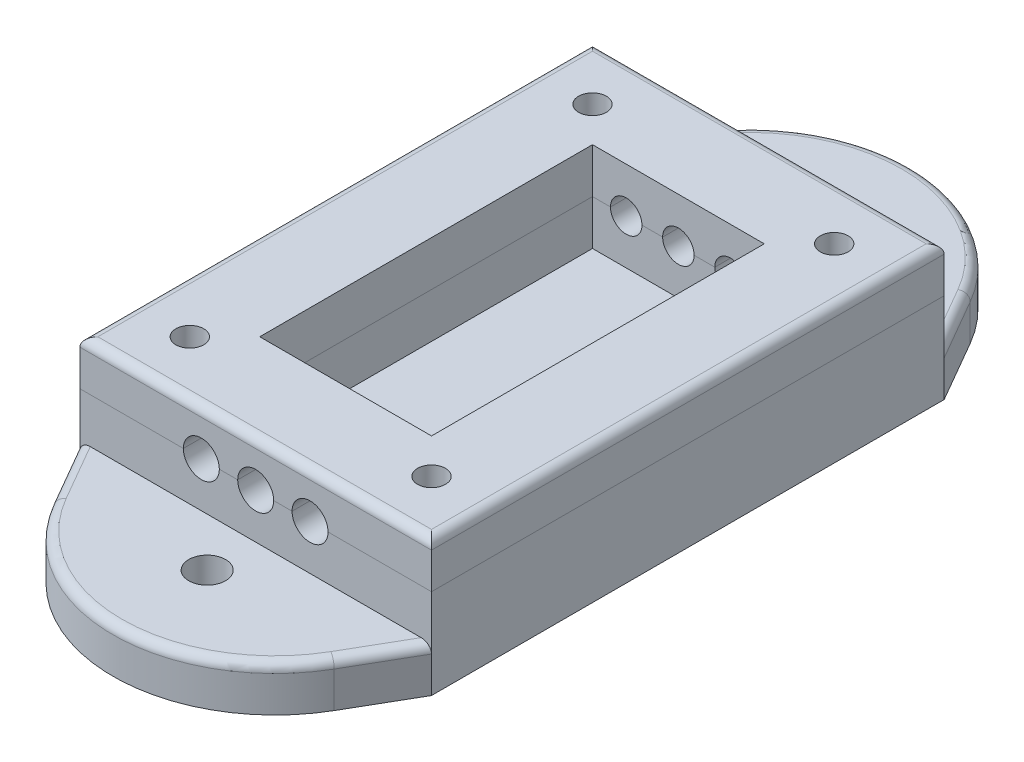
from build123d import *

# Parameters (mm, degrees)
BOSS_EXTRU_1_DEPTH           = 20
CONG_1_R                     = 0.5
CONG_2_R                     = 1
ESQUISSE3_W                  = 39.099999999999994
ESQUISSE3_H                  = 57
ESQUISSE3_R                  = 1.5499999999999992
ESQUISSE3_R_2                = 1.5499999999999883
ESQUISSE3_W_2                = 19.1
ESQUISSE3_H_2                = 37
BOSS_EXTRU_2_DEPTH           = 5
ESQUISSE3_3_W                = 39.099999999999994
ESQUISSE3_3_H                = 57
ESQUISSE3_3_R                = 1.5499999999999992
ESQUISSE3_3_R_2              = 1.5499999999999883
ESQUISSE3_3_W_2              = 19.1
ESQUISSE3_3_H_2              = 37
BOSS_EXTRU_4_DEPTH           = 15
TROUS_MOTEUR_REACH           = 58.757
ESQUISSE8_R                  = 1.7500000000000038
ESQUISSE8_R_2                = 1.750000000000003
ENL_V_MAT_EXTRU_1_DEPTH      = 50.94617008369277
TROUS_CABLES_PUISSANCE_REACH = 58.757
ESQUISSE9_R                  = 2
ESQUISSE9_R_2                = 2.000000000000005
ESQUISSE9_R_3                = 2.0000000000000053
ENL_V_MAT_EXTRU_5_REACH      = 51.946
ESQUISSE12_W                 = 5.9
ESQUISSE12_H                 = 1.620000000000001
ESQUISSE13_R                 = 2.05
BOSS_EXTRU_5_DEPTH           = 5
CONG_3_R                     = 1
FRACTIONNER1_SURFACE_1_BACK  = 99.11
FRACTIONNER1_SURFACE_1_DEPTH = 198.22
FRACTIONNER1_SURFACE_2_BACK  = 99.11
FRACTIONNER1_SURFACE_2_DEPTH = 198.22


with BuildPart() as part:
    # Esquisse1 → Boss.-Extru.1 (new body)
    with BuildSketch(Plane.XY):
        Polygon((-1.176e-14, 10.103135382441117), (-2.578e-14, 4.840000000000001), (3.5, 4.840000000000001), (5.71, 6.983135382441116), (5.71, 8.483135382441116), (2.95, 8.483135382441116), (2.95, 10.103135382441117), align=None)
        Polygon((-3.5, 4.840000000000001), (-2.576e-14, 4.840000000000001), (-1.176e-14, 10.103135382441117), (-2.95, 10.103135382441117), (-2.95, 8.483135382441116), (-5.71, 8.483135382441116), (-5.71, 6.983135382441116), align=None)
    extrude(amount=-BOSS_EXTRU_1_DEPTH)

    # Congé1
    cong_1_edges = [part.edges().sort_by_distance(p)[0] for p in [
        (5.71, 7.733135382441116, 0),
        (4.605, 5.911567691220558, 0),
        (0, 4.840000000000001, 0),
        (-4.605, 5.911567691220558, 0),
        (-5.71, 7.733135382441116, 0),
        (-5.71, 7.733135382441116, -20),
        (-4.605, 5.911567691220558, -20),
        (0, 4.840000000000001, -20),
        (4.605, 5.911567691220558, -20),
        (5.71, 7.733135382441116, -20),
    ]]
    fillet(cong_1_edges, radius=CONG_1_R)

    # Congé2
    # the kernel refuses this fillet: 1 mm, written as the material it takes off along each edge
    with BuildSketch(Plane(origin=(4.71, 7.4063748668930085, -20), x_dir=(1, 0, 0), z_dir=(0, 1, 0))) as cong_2_piece_1:
        with BuildLine():
            CenterArc((0.5, -0.5), 0.5, 0, 90)
            Line((1, -0.5), (1, 0))
            Line((1, 0), (0.5, 0))
        make_face()
    revolve(axis=Axis((4.71, 7.4063748668930085, -20), (0, 0, -1)), revolution_arc=45.87999999999987, mode=Mode.SUBTRACT)
    with BuildSketch(Plane(origin=(-4.710000000000001, 7.40637486689301, -20), x_dir=(-0.6961634275566162, -0.717883334625219, 0), z_dir=(0.717883334625219, -0.6961634275566162, 0))) as cong_2_piece_2:
        with BuildLine():
            CenterArc((0.5, -0.5), 0.5, 0, 90)
            Line((1, -0.5), (1, 0))
            Line((1, 0), (0.5, 0))
        make_face()
    revolve(axis=Axis((-4.710000000000001, 7.40637486689301, -20), (0, 0, -1)), revolution_arc=45.87999999999987, mode=Mode.SUBTRACT)
    with BuildSketch(Plane(origin=(4.71, 7.4063748668930085, 0), x_dir=(0.6961634275566162, -0.717883334625219, 0), z_dir=(-0.717883334625219, -0.6961634275566162, 0))) as cong_2_piece_3:
        with BuildLine():
            CenterArc((0.5, -0.5), 0.5, 0, 90)
            Line((1, -0.5), (1, 0))
            Line((1, 0), (0.5, 0))
        make_face()
    revolve(axis=Axis((4.71, 7.4063748668930085, 0), (0, 0, 1)), revolution_arc=45.87999999999987, mode=Mode.SUBTRACT)
    with BuildSketch(Plane(origin=(-4.710000000000001, 7.40637486689301, 0), x_dir=(-1, 0, 0), z_dir=(0, 1, 0))) as cong_2_piece_4:
        with BuildLine():
            CenterArc((0.5, -0.5), 0.5, 0, 90)
            Line((1, -0.5), (1, 0))
            Line((1, 0), (0.5, 0))
        make_face()
    revolve(axis=Axis((-4.710000000000001, 7.40637486689301, 0), (0, 0, 1)), revolution_arc=45.87999999999987, mode=Mode.SUBTRACT)
    with BuildSketch(Plane(origin=(-5.71, 6.983135382441116, 1.1e-16), x_dir=(0.717883334625219, -0.6961634275566161, 0), z_dir=(0, 0, -1))) as cong_2_piece_5:
        with BuildLine():
            CenterArc((CONG_2_R * 0.423239484452, -CONG_2_R), CONG_2_R, 90.00000000000003, 45.879999999999825)
            Line((-CONG_2_R * 0.294643850173, -CONG_2_R * 0.303836572443), (0, 0))
            Line((0, 0), (CONG_2_R * 0.423239484452, 0))
        make_face()
    extrude(amount=20, mode=Mode.SUBTRACT)
    with BuildSketch(Plane(origin=(5.71, 6.983135382441116, 1.1e-16), x_dir=(-0.7178833346252179, -0.6961634275566172, 0), z_dir=(0, 0, -1))) as cong_2_piece_6:
        with BuildLine():
            CenterArc((CONG_2_R * 0.423239484452, CONG_2_R), CONG_2_R, 224.12000000000015, 45.87999999999994)
            Line((-CONG_2_R * 0.294643850173, CONG_2_R * 0.303836572443), (0, 0))
            Line((0, 0), (CONG_2_R * 0.423239484452, 2e-17))
        make_face()
    extrude(amount=20, mode=Mode.SUBTRACT)

    # Esquisse3 → Boss.-Extru.2 (add)
    # profile 1 of 6: a face of its own
    with BuildSketch(Plane(origin=(0, 10.103135382441117, 0), x_dir=(1, 0, 0), z_dir=(0, 1, 0))):
        with Locations((0, 10)):
            Rectangle(ESQUISSE3_W, ESQUISSE3_H)
        with Locations((13.43908729652601, -12.389087296526013)):
            Circle(ESQUISSE3_R, mode=Mode.SUBTRACT)
        with Locations((-13.43908729652601, -12.389087296526013)):
            Circle(ESQUISSE3_R, mode=Mode.SUBTRACT)
        with Locations((13.439087296526004, 32.389087296526014)):
            Circle(ESQUISSE3_R_2, mode=Mode.SUBTRACT)
        with Locations((-13.439087296526015, 32.389087296526014)):
            Circle(ESQUISSE3_R_2, mode=Mode.SUBTRACT)
        with Locations((1.78e-15, 10.000000000000004)):
            Rectangle(ESQUISSE3_W_2, ESQUISSE3_H_2, mode=Mode.SUBTRACT)
    # profile 2 of 6: a face of its own
    with BuildSketch(Plane(origin=(0, 10.103135382441117, 0), x_dir=(1, 0, 0), z_dir=(0, 1, 0))):
        with Locations((13.439087296526004, 32.389087296526014)):
            Circle(ESQUISSE3_R_2)
    # profile 3 of 6: a face of its own
    with BuildSketch(Plane(origin=(0, 10.103135382441117, 0), x_dir=(1, 0, 0), z_dir=(0, 1, 0))):
        with Locations((-13.439087296526015, 32.389087296526014)):
            Circle(ESQUISSE3_R_2)
    # profile 4 of 6: a face of its own
    with BuildSketch(Plane(origin=(0, 10.103135382441117, 0), x_dir=(1, 0, 0), z_dir=(0, 1, 0))):
        with Locations((-13.43908729652601, -12.389087296526013)):
            Circle(ESQUISSE3_R)
    # profile 5 of 6: a face of its own
    with BuildSketch(Plane(origin=(0, 10.103135382441117, 0), x_dir=(1, 0, 0), z_dir=(0, 1, 0))):
        with Locations((13.43908729652601, -12.389087296526013)):
            Circle(ESQUISSE3_R)
    # profile 6 of 6: a face of its own
    with BuildSketch(Plane(origin=(0, 10.103135382441117, 0), x_dir=(1, 0, 0), z_dir=(0, 1, 0))):
        Polygon((-9.549999999999999, 28.500000000000004), (-9.549999999999999, -8.499999999999996), (9.550000000000002, -8.499999999999998), (9.550000000000002, 28.500000000000004), align=None)
    extrude(amount=BOSS_EXTRU_2_DEPTH)

    # Esquisse3<3> → Boss.-Extru.4 (add)
    with BuildSketch(Plane(origin=(0, 10.103135382441117, 0), x_dir=(1, 0, 0), z_dir=(0, 1, 0))):
        with Locations((0, 10)):
            Rectangle(ESQUISSE3_3_W, ESQUISSE3_3_H)
        with Locations(Location((-13.43908729652601, -12.389087296526013, 0), (0, 0, 270))):
            Circle(ESQUISSE3_3_R, mode=Mode.SUBTRACT)
        with Locations(Location((13.43908729652601, -12.389087296526013, 0), (0, 0, 90))):
            Circle(ESQUISSE3_3_R, mode=Mode.SUBTRACT)
        with Locations(Location((13.439087296526004, 32.389087296526014, 0), (0, 0, 270))):
            Circle(ESQUISSE3_3_R_2, mode=Mode.SUBTRACT)
        with Locations(Location((-13.439087296526015, 32.389087296526014, 0), (0, 0, 90))):
            Circle(ESQUISSE3_3_R_2, mode=Mode.SUBTRACT)
        with Locations((1.78e-15, 10.000000000000004)):
            Rectangle(ESQUISSE3_3_W_2, ESQUISSE3_3_H_2, mode=Mode.SUBTRACT)
    extrude(amount=BOSS_EXTRU_4_DEPTH)

    # Esquisse8 → Trous_moteur (cut, up to next)
    with BuildSketch(Plane.XY.offset(-28.500000000000004), mode=Mode.PRIVATE) as trous_moteur_sk1:
        with Locations((5.800000000000003, 20.103135382441113)):
            Circle(ESQUISSE8_R)
    trous_moteur_tool1 = extrude(trous_moteur_sk1.sketch, amount=-TROUS_MOTEUR_REACH, mode=Mode.PRIVATE) & part.part
    # Esquisse8 → Trous_moteur (cut, up to next)
    with BuildSketch(Plane.XY.offset(-28.500000000000004), mode=Mode.PRIVATE) as trous_moteur_sk2:
        with Locations((3.47e-15, 20.10313538244111)):
            Circle(ESQUISSE8_R_2)
    trous_moteur_tool2 = extrude(trous_moteur_sk2.sketch, amount=-TROUS_MOTEUR_REACH, mode=Mode.PRIVATE) & part.part
    # Esquisse8 → Trous_moteur (cut, up to next)
    with BuildSketch(Plane.XY.offset(-28.500000000000004), mode=Mode.PRIVATE) as trous_moteur_sk3:
        with Locations((-5.799999999999996, 20.10313538244111)):
            Circle(ESQUISSE8_R)
    trous_moteur_tool3 = extrude(trous_moteur_sk3.sketch, amount=-TROUS_MOTEUR_REACH, mode=Mode.PRIVATE) & part.part
    add(trous_moteur_tool1.solids().sort_by_distance((5.8, 20.103135, -28.5))[0], mode=Mode.SUBTRACT)
    add(trous_moteur_tool2.solids().sort_by_distance((0, 20.103135, -28.5))[0], mode=Mode.SUBTRACT)
    add(trous_moteur_tool3.solids().sort_by_distance((-5.8, 20.103135, -28.5))[0], mode=Mode.SUBTRACT)

    # Esquisse5 → Enlèv. mat.-Extru.1 (cut, through all)
    with BuildSketch(Plane.XY):
        with BuildLine():
            Line((-5.209999999999999, 8.483135382441116), (-5.71, 8.483135382441116))
            Line((-5.71, 8.483135382441116), (-5.71, 7.4063748668930085))
            ThreePointArc((-5.71, 7.4063748668930085), (-5.630913521335368, 7.01660790289825), (-5.406163427556616, 6.68849153226779))
            Line((-5.406163427556616, 6.68849153226779), (-3.5, 4.840000000000001))
            Line((-3.5, 4.840000000000001), (3.5, 4.840000000000001))
            Line((3.5, 4.840000000000001), (5.406163427556617, 6.68849153226779))
            ThreePointArc((5.406163427556617, 6.68849153226779), (5.630913521335369, 7.01660790289825), (5.71, 7.406374866893009))
            Line((5.71, 7.406374866893009), (5.71, 8.483135382441116))
            Line((5.71, 8.483135382441116), (5.209999999999999, 8.483135382441116))
            Line((5.209999999999999, 8.483135382441116), (2.95, 8.483135382441116))
            Line((2.95, 8.483135382441116), (-2.95, 8.483135382441116))
            Line((-2.95, 8.483135382441116), (-5.209999999999999, 8.483135382441116))
        make_face()
    extrude(amount=-ENL_V_MAT_EXTRU_1_DEPTH, mode=Mode.SUBTRACT)

    # Esquisse9 → Trous_cables_puissance (cut, up to next)
    with BuildSketch(Plane(origin=(0, 0, 8.499999999999998), x_dir=(-1, 0, 0), z_dir=(0, 0, -1)), mode=Mode.PRIVATE) as trous_cables_puissance_sk1:
        with Locations((6.044999999999998, 20.103135382441113)):
            Circle(ESQUISSE9_R)
    trous_cables_puissance_tool1 = extrude(trous_cables_puissance_sk1.sketch, amount=-TROUS_CABLES_PUISSANCE_REACH, mode=Mode.PRIVATE) & part.part
    # Esquisse9 → Trous_cables_puissance (cut, up to next)
    with BuildSketch(Plane(origin=(0, 0, 8.499999999999998), x_dir=(-1, 0, 0), z_dir=(0, 0, -1)), mode=Mode.PRIVATE) as trous_cables_puissance_sk2:
        with Locations((-6.045000000000002, 20.103135382441113)):
            Circle(ESQUISSE9_R_2)
    trous_cables_puissance_tool2 = extrude(trous_cables_puissance_sk2.sketch, amount=-TROUS_CABLES_PUISSANCE_REACH, mode=Mode.PRIVATE) & part.part
    # Esquisse9 → Trous_cables_puissance (cut, up to next)
    with BuildSketch(Plane(origin=(0, 0, 8.499999999999998), x_dir=(-1, 0, 0), z_dir=(0, 0, -1)), mode=Mode.PRIVATE) as trous_cables_puissance_sk3:
        with Locations((-1.73e-15, 20.103135382441113)):
            Circle(ESQUISSE9_R_3)
    trous_cables_puissance_tool3 = extrude(trous_cables_puissance_sk3.sketch, amount=-TROUS_CABLES_PUISSANCE_REACH, mode=Mode.PRIVATE) & part.part
    add(trous_cables_puissance_tool1.solids().sort_by_distance((-6.045, 20.103135, 8.5))[0], mode=Mode.SUBTRACT)
    add(trous_cables_puissance_tool2.solids().sort_by_distance((6.045, 20.103135, 8.5))[0], mode=Mode.SUBTRACT)
    add(trous_cables_puissance_tool3.solids().sort_by_distance((0, 20.103135, 8.5))[0], mode=Mode.SUBTRACT)

    # Esquisse12 → Enlèv. mat.-Extru.5 (cut, up to next)
    with BuildSketch(Plane(origin=(0, 0, -20), x_dir=(-1, 0, 0), z_dir=(0, 0, -1)), mode=Mode.PRIVATE) as enl_v_mat_extru_5_sk1:
        with Locations((0, 9.293135382441116)):
            Rectangle(ESQUISSE12_W, ESQUISSE12_H)
    enl_v_mat_extru_5_tool1 = extrude(enl_v_mat_extru_5_sk1.sketch, amount=-ENL_V_MAT_EXTRU_5_REACH, mode=Mode.PRIVATE) & part.part
    add(enl_v_mat_extru_5_tool1.solids().sort_by_distance((0, 9.293135, -20))[0], mode=Mode.SUBTRACT)

    # Esquisse13 → Boss.-Extru.5 (add)
    with BuildSketch(Plane.XZ.offset(-10.103135382441117)):
        with BuildLine():
            Line((-19.549999999999997, 18.5), (-15.58845726811995, 25.361593287971516))
            ThreePointArc((-15.58845726811995, 25.361593287971516), (-5.708e-14, 34.36159328797158), (15.588457268119866, 25.361593287971584))
            Line((15.588457268119866, 25.361593287971584), (19.549999999999997, 18.5))
            Line((19.549999999999997, 18.5), (-19.549999999999997, 18.5))
        make_face()
        with Locations(Location((0, 23.895, 0), (0, 0, 270))):
            Circle(ESQUISSE13_R, mode=Mode.SUBTRACT)
    boss_extru_5 = extrude(amount=-BOSS_EXTRU_5_DEPTH)

    # Symétrie1: Boss.-Extru.5 across plane
    add(boss_extru_5.mirror(Plane.XY.offset(-10)))

    # Congé3
    cong_3_edges = [part.edges().sort_by_distance(p)[0] for p in [
        (19.549999999999997, 25.103135382441117, -10),
        (0, 25.103135382441117, -38.5),
        (-19.549999999999997, 25.103135382441117, -10),
        (0, 25.103135382441117, 18.5),
        (-17.569228634059975, 15.103135382441117, 21.930796643985758),
        (-6.084e-14, 15.103135382441117, 34.36159328797157),
        (17.569228634059932, 15.103135382441117, 21.930796643985794),
        (17.569228634059932, 15.103135382441117, -41.93079664398579),
        (-6.084e-14, 15.103135382441117, -54.36159328797157),
        (-17.56922863405997, 15.103135382441117, -41.93079664398576),
    ]]
    fillet(cong_3_edges, radius=CONG_3_R)


with BuildPart() as body_2:
    # Fractionner1: the piece behind the surface
    add(part.part)
    # Fractionner1 surface: a surface, the sketch's curves swept straight by 198.22 mm
    with BuildLine(Plane.XY.offset(18.5).offset(-FRACTIONNER1_SURFACE_1_BACK), mode=Mode.PRIVATE) as fractionner1_surface_1_path:
        Line((19.549999999999997, 20.103135382441113), (-19.549999999999997, 20.10313538244111))
        Line((-19.549999999999997, 20.10313538244111), (-19.549999999999997, 24.103135382441113))
        ThreePointArc((-19.549999999999997, 24.103135382441113), (-19.257106781186547, 24.810242163627663), (-18.549999999999997, 25.103135382441117))
        Line((-18.549999999999997, 25.103135382441117), (18.549999999999997, 25.103135382441117))
        ThreePointArc((18.549999999999997, 25.103135382441117), (19.257106781186543, 24.81024216362766), (19.549999999999997, 24.103135382441113))
        Line((19.549999999999997, 24.103135382441113), (19.549999999999997, 20.103135382441113))
    fractionner1_surface_1 = Shell.extrude(fractionner1_surface_1_path.wire(), (0 * FRACTIONNER1_SURFACE_1_DEPTH, 0 * FRACTIONNER1_SURFACE_1_DEPTH, 1 * FRACTIONNER1_SURFACE_1_DEPTH))
    split(bisect_by=fractionner1_surface_1, keep=Keep.BOTTOM)


with BuildPart() as part_1:
    add(part.part)

    # Fractionner1: split by a surface, the side it looks to stays
    # Fractionner1 surface: a surface, the sketch's curves swept straight by 198.22 mm
    with BuildLine(Plane.XY.offset(18.5).offset(-FRACTIONNER1_SURFACE_2_BACK), mode=Mode.PRIVATE) as fractionner1_surface_2_path:
        Line((19.549999999999997, 20.103135382441113), (-19.549999999999997, 20.10313538244111))
        Line((-19.549999999999997, 20.10313538244111), (-19.549999999999997, 24.103135382441113))
        ThreePointArc((-19.549999999999997, 24.103135382441113), (-19.257106781186547, 24.810242163627663), (-18.549999999999997, 25.103135382441117))
        Line((-18.549999999999997, 25.103135382441117), (18.549999999999997, 25.103135382441117))
        ThreePointArc((18.549999999999997, 25.103135382441117), (19.257106781186543, 24.81024216362766), (19.549999999999997, 24.103135382441113))
        Line((19.549999999999997, 24.103135382441113), (19.549999999999997, 20.103135382441113))
    fractionner1_surface_2 = Shell.extrude(fractionner1_surface_2_path.wire(), (0 * FRACTIONNER1_SURFACE_2_DEPTH, 0 * FRACTIONNER1_SURFACE_2_DEPTH, 1 * FRACTIONNER1_SURFACE_2_DEPTH))
    split(bisect_by=fractionner1_surface_2, keep=Keep.TOP)


solid = Compound([body_2.part, part_1.part])
